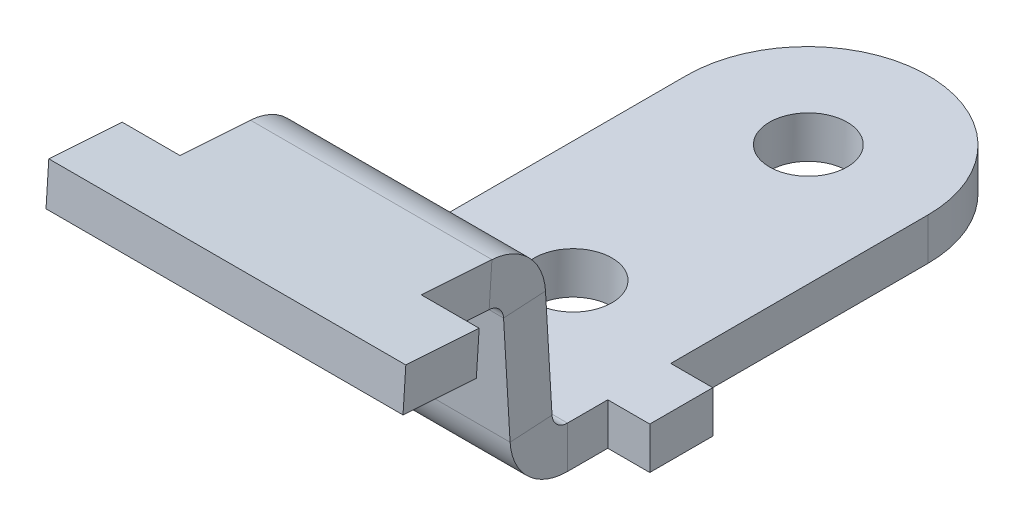
from build123d import *

# Parameters (mm, degrees)
T_LE_DE_BASE_PLI_E1_DEPTH = 5.75
ESQUISSE6_W               = 2
ESQUISSE6_H               = 3
PATTE1_DEPTH              = 2
ESQUISSE9_W               = 2.75
ESQUISSE9_H               = 3.5
PATTE2_DEPTH              = 2
ESQUISSE12_R              = 1.85
ENL_V_MAT_EXTRU_1_DEPTH   = 10
CONG_1_R                  = 5.75


# Sheet-metal steps are written as plain solids
with BuildPart() as part:
    # Esquisse1 → Tôle de base pliée1 (new body)
    with BuildSketch(Plane(origin=(0, 0, 0), x_dir=(0, 0, -1), z_dir=(1, 0, 0))):
        with BuildLine():
            Line((0, 0), (-22.919645957, 0))
            ThreePointArc((-22.919645957, 0), (-24.797039301, 0.745526473), (-25.651523607, 2.575901315))
            Line((-25.651523607, 2.575901315), (-25.961852844, 7.85149835))
            ThreePointArc((-25.961852844, 7.85149835), (-26.174296323, 8.327060048), (-26.648183844, 8.543212256))
            Line((-26.648183844, 8.543212256), (-33.5, 9))
            Line((-33.5, 9), (-33.366961979, 10.995570316))
            Line((-33.366961979, 10.995570316), (-26.515145823, 10.538782572))
            ThreePointArc((-26.515145823, 10.538782572), (-24.754569405, 9.735738676), (-23.965304098, 7.968942394))
            Line((-23.965304098, 7.968942394), (-23.65497486, 2.693345359))
            ThreePointArc((-23.65497486, 2.693345359), (-23.424976637, 2.200670467), (-22.919645957, 2))
            Line((-22.919645957, 2), (0, 2))
            Line((0, 2), (0, 0))
        make_face()
    extrude(amount=T_LE_DE_BASE_PLI_E1_DEPTH)

    # Esquisse6 → Patte1 (add)
    with BuildSketch(Plane(origin=(0, 2, 0), x_dir=(1, 0, 0), z_dir=(0, 1, 0))):
        with Locations((6.75, -19.5)):
            Rectangle(ESQUISSE6_W, ESQUISSE6_H)
    extrude(amount=-PATTE1_DEPTH)

    # Esquisse9 → Patte2 (add)
    with BuildSketch(Plane(origin=(0, 8.732295979, -0.582153065), x_dir=(1, 0, 0), z_dir=(0, 0.997785157856609, -0.06651901052377376))):
        with Locations((7.125, -32.274473883)):
            Rectangle(ESQUISSE9_W, ESQUISSE9_H)
    extrude(amount=-PATTE2_DEPTH)

    # Esquisse12 → Enlèv. mat.-Extru.1 (cut)
    with BuildSketch(Plane(origin=(0, 2, 0), x_dir=(1, 0, 0), z_dir=(0, 1, 0))):
        with Locations((0, -5.7)):
            Circle(ESQUISSE12_R)
        with Locations((0, -16.9)):
            Circle(ESQUISSE12_R)
    extrude(amount=-ENL_V_MAT_EXTRU_1_DEPTH, mode=Mode.SUBTRACT)

    # Congé1
    cong_1_edges = [part.edges().sort_by_distance(p)[0] for p in [
        (5.75, 1, 0),
    ]]
    fillet(cong_1_edges, radius=CONG_1_R - 0.0001)  # a hair under: the kernel refuses the full size

    # Symétrie1: part across plane


with BuildPart() as part_1:
    add(part.part)
    add(part.part.mirror(Plane(origin=(0, 2.693345359, 23.65497486), x_dir=(0, 0, 1), z_dir=(-1, 0, 0))))


solid = part_1.part
